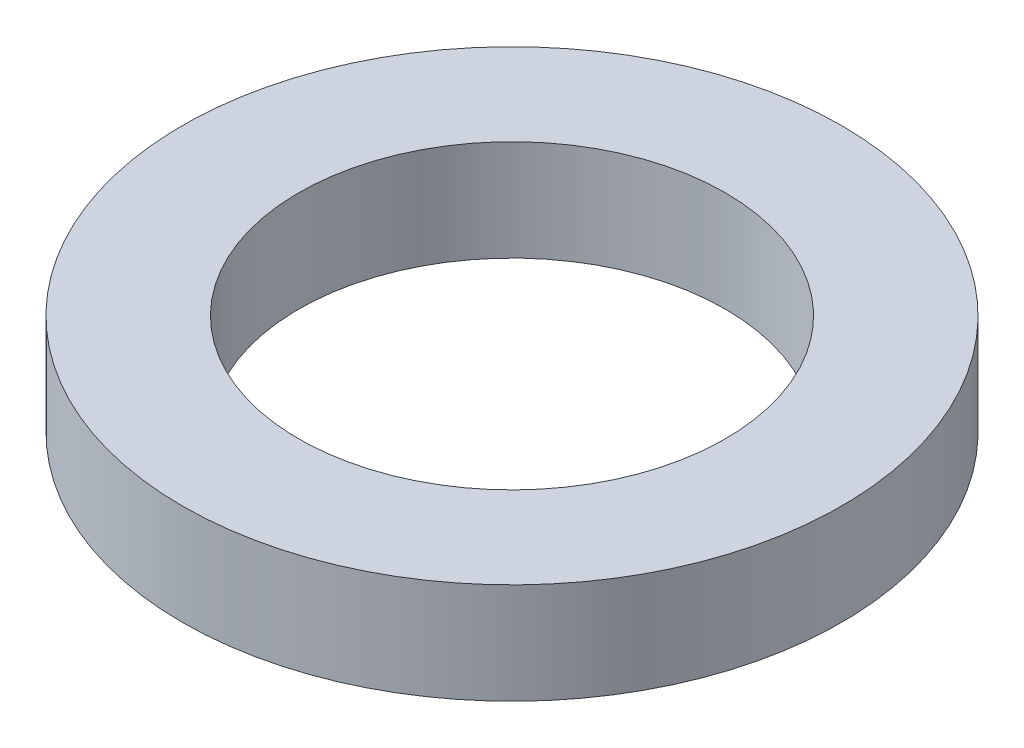
from build123d import *

# Parameters (mm, degrees)
SKETCH1_R           = 42.5
BOSS_EXTRUDE1_DEPTH = 13
SKETCH2_R           = 27.5
CUT_EXTRUDE1_DEPTH  = 62.493902137


with BuildPart() as part:
    # Sketch1 → Boss-Extrude1 (new body)
    with BuildSketch(Plane(origin=(0, 0, 0), x_dir=(1, 0, 0), z_dir=(0, 1, 0))):
        Circle(SKETCH1_R)
    extrude(amount=BOSS_EXTRUDE1_DEPTH)

    # Sketch2 → Cut-Extrude1 (cut, through all)
    with BuildSketch(Plane(origin=(0, 0, 0), x_dir=(1, 0, 0), z_dir=(0, 1, 0))):
        Circle(SKETCH2_R)
    extrude(amount=CUT_EXTRUDE1_DEPTH, mode=Mode.SUBTRACT)


solid = part.part
